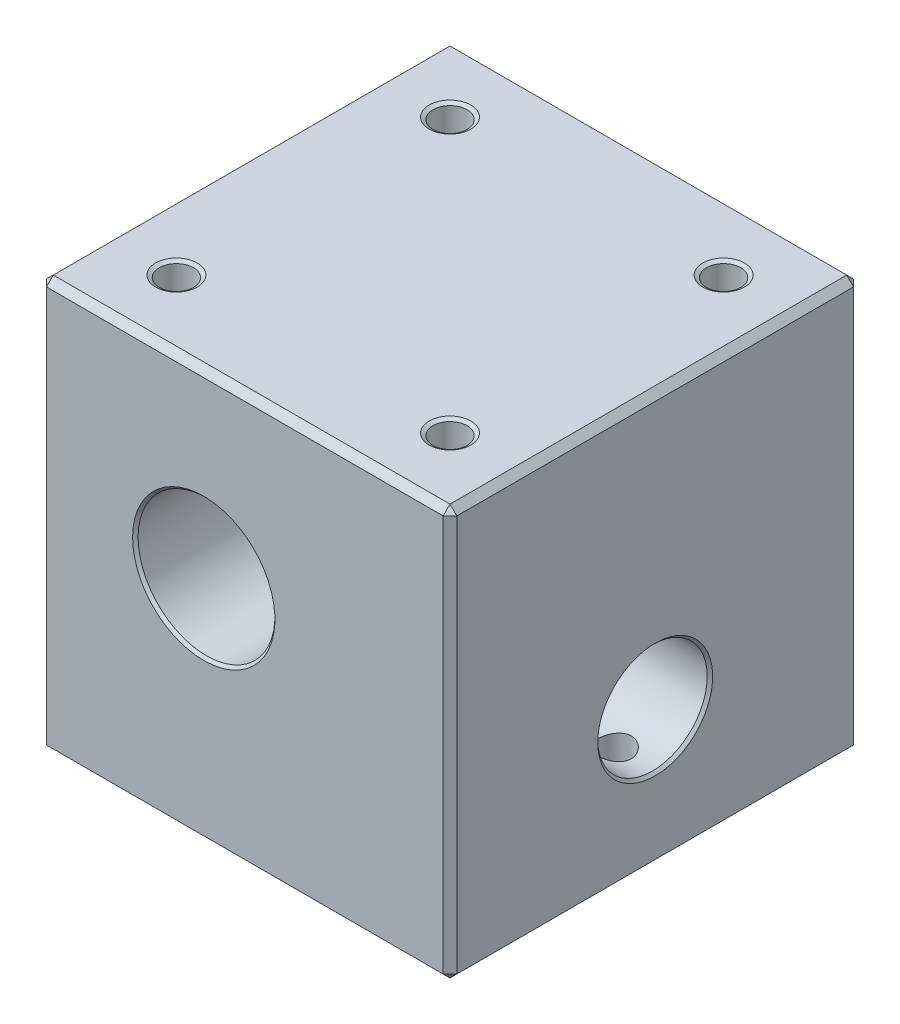
from build123d import *

# Parameters (mm, degrees)
SCHIZZO1_W                      = 30
SCHIZZO1_H                      = 30
SCHIZZO1_R                      = 5
ESTRUSIONE_ESTRUSIONE1_DEPTH    = 30
F_8_0_8_DIAMETER_HOLE1_D        = 8
F_8_0_8_DIAMETER_HOLE1_DEPTH    = 13.5
F_8_0_8_DIAMETER_HOLE1_TIP      = 2.403442476
FORO_FILETTATO_M3_1_AT_2_COUNT  = 2
FORO_FILETTATO_M3_1_AT_2_PITCH  = 20
FORO_FILETTATO_M3_2_D           = 2.5
FORO_FILETTATO_M3_2_DEPTH       = 8.5
FORO_FILETTATO_M3_2_CSINK_D     = 3.05
FORO_FILETTATO_M3_2_CSINK_ANGLE = 120
FORO_FILETTATO_M3_2_TIP         = 0.751075774
CHAMFER1_SIZE                   = 0.5
CHAMFER2_SIZE                   = 0.2


with BuildPart() as part:
    # Schizzo1 → Estrusione-Estrusione1 (new body)
    with BuildSketch(Plane.XY):
        with Locations((15, 15)):
            Rectangle(SCHIZZO1_W, SCHIZZO1_H)
        with Locations((12, 16.8)):
            Circle(SCHIZZO1_R, mode=Mode.SUBTRACT)
    extrude(amount=ESTRUSIONE_ESTRUSIONE1_DEPTH)

    # Ø8.0 (8) Diameter Hole1
    with Locations(Plane(origin=(30, 0, 0), x_dir=(0, 0, -1), z_dir=(1, 0, 0))):
        with Locations((-15, 10)):
            Hole(F_8_0_8_DIAMETER_HOLE1_D / 2, depth=F_8_0_8_DIAMETER_HOLE1_DEPTH)
            with Locations((0, 0, -(F_8_0_8_DIAMETER_HOLE1_DEPTH + F_8_0_8_DIAMETER_HOLE1_TIP / 2))):  # 118° drill point
                Cone(0, F_8_0_8_DIAMETER_HOLE1_D / 2, F_8_0_8_DIAMETER_HOLE1_TIP, mode=Mode.SUBTRACT)

    # Schizzo7 → Foro filettato M3-1 (revolve, cut)
    with BuildSketch(Plane(origin=(5, 30, 25), x_dir=(0, 0, 1), z_dir=(1, 0, 0))):
        Polygon((0, 0), (0, 9.251075774), (1.25, 8.5), (1.25, 0.158771324), (1.525, 0), align=None)
    foro_filettato_m3_1 = revolve(axis=Axis((5, 36.35, 25), (0, -1, 0)), mode=Mode.SUBTRACT)

    # Foro filettato M3-1 at 2: Foro filettato M3-1 ×2
    with Locations(*[(i * FORO_FILETTATO_M3_1_AT_2_PITCH, 0, 0) for i in range(1, FORO_FILETTATO_M3_1_AT_2_COUNT)]):
        add(foro_filettato_m3_1, mode=Mode.SUBTRACT)

    # Specchia1: Foro filettato M3-1 across plane
    add(foro_filettato_m3_1.mirror(Plane.XY.offset(15)), mode=Mode.SUBTRACT)

    # Specchia1 copy 1 sketch → Specchia1 copy 1 (revolve, cut)
    with BuildSketch(Plane(origin=(25, 30, 5), x_dir=(0, 0, -1), z_dir=(1, 0, 0))):
        Polygon((0, 0), (0, -9.251075774), (1.25, -8.5), (1.25, -0.158771324), (1.525, 0), align=None)
    revolve(axis=Axis((25, 36.35, 5), (0, 1, 0)), mode=Mode.SUBTRACT)

    # Foro filettato M3-2
    with Locations(Plane(origin=(0, 0, 0), x_dir=(-1, 0, 0), z_dir=(0, -1, 0))):
        with Locations((-27, -15)):
            CounterSinkHole(FORO_FILETTATO_M3_2_D / 2, FORO_FILETTATO_M3_2_CSINK_D / 2, depth=FORO_FILETTATO_M3_2_DEPTH, counter_sink_angle=FORO_FILETTATO_M3_2_CSINK_ANGLE)
            with Locations((0, 0, -(FORO_FILETTATO_M3_2_DEPTH + FORO_FILETTATO_M3_2_TIP / 2))):  # 118° drill point
                Cone(0, FORO_FILETTATO_M3_2_D / 2, FORO_FILETTATO_M3_2_TIP, mode=Mode.SUBTRACT)

    # Chamfer1
    chamfer1_edges = [part.edges().sort_by_distance(p)[0] for p in [
        (30, 15, 0),
        (15, 0, 0),
        (0, 0, 15),
        (15, 0, 30),
        (30, 0, 15),
        (0, 15, 0),
        (0, 15, 30),
        (30, 15, 30),
        (15, 30, 0),
        (30, 30, 15),
        (0, 30, 15),
        (15, 30, 30),
    ]]
    chamfer(chamfer1_edges, length=CHAMFER1_SIZE)

    # Chamfer2
    chamfer2_edges = [part.edges().sort_by_distance(p)[0] for p in [
        (7, 16.8, 0),
        (7, 16.8, 30),
        (30, 10, 11),
    ]]
    chamfer(chamfer2_edges, length=CHAMFER2_SIZE)


solid = part.part
